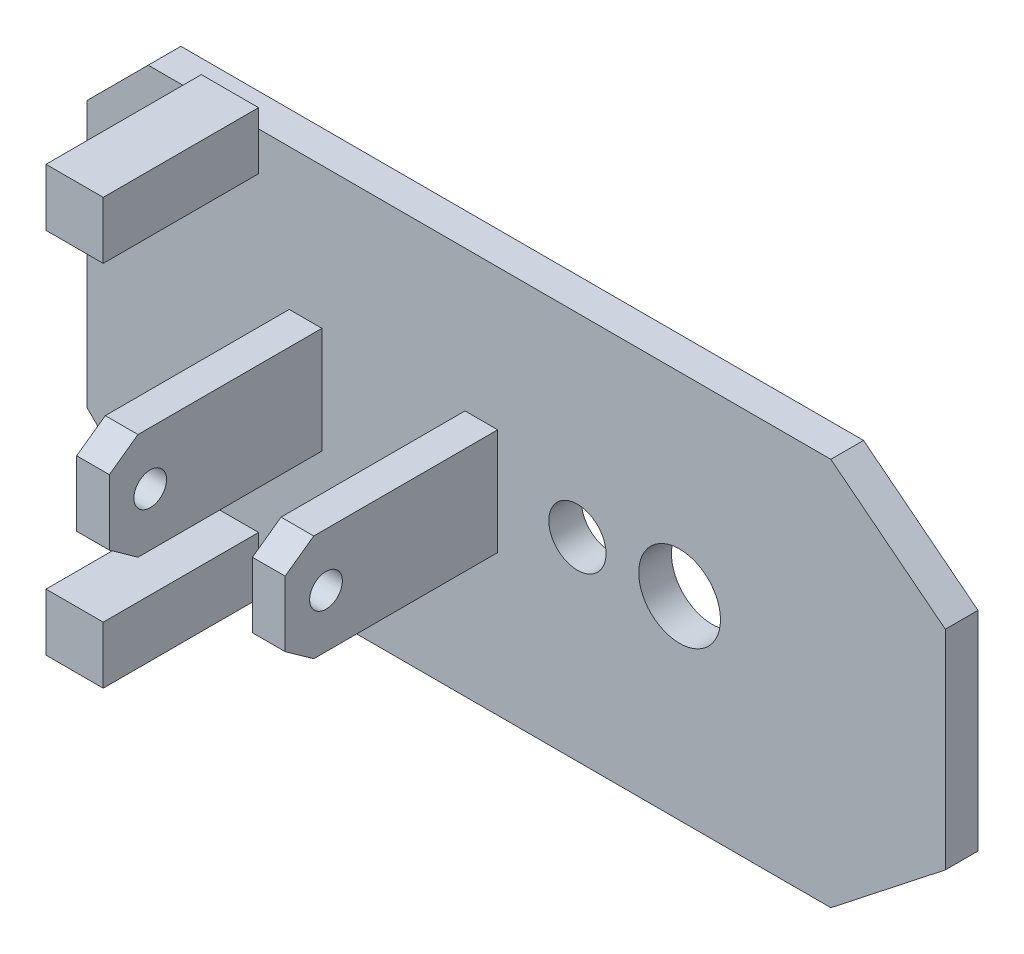
from build123d import *

# Parameters (mm, degrees)
SK_SOLE_PLATE_R    = 10
SK_SOLE_PLATE_R_2  = 7
SOLE_PLATE_DEPTH   = 8
SK_CLEVIS_FRONT_R  = 4
CLEVIS_FRONT_DEPTH = 8
SK_CLEVIS_BACK_R   = 4
CLEVIS_BACK_DEPTH  = 8
SK_POST_LAT_W      = 14
SK_POST_LAT_H      = 14
POST_LAT_DEPTH     = 38
SK_POST_MED_W      = 14
SK_POST_MED_H      = 14
POST_MED_DEPTH     = 38


with BuildPart() as part:
    # SK_Sole_Plate → Sole_Plate (new body)
    with BuildSketch(Plane.XY.offset(-50)):
        Polygon((-60, 47.5), (107, 47.5), (135, 25.5), (135, -25.5), (107, -47.5), (-60, -47.5), (-75, -32.5), (-75, 32.5), align=None)
        with Locations((70, 0)):
            Circle(SK_SOLE_PLATE_R, mode=Mode.SUBTRACT)
        with Locations((45, 0)):
            Circle(SK_SOLE_PLATE_R_2, mode=Mode.SUBTRACT)
    extrude(amount=SOLE_PLATE_DEPTH)

    # SK_Clevis_Front → Clevis_Front (add)
    with BuildSketch(Plane(origin=(17.5, 0, 0), x_dir=(0, 0, -1), z_dir=(1, 0, 0))):
        Polygon((42, 13), (42, -13), (-3, -13), (-10, -8), (-10, 8), (-3, 13), align=None)
        Circle(SK_CLEVIS_FRONT_R, mode=Mode.SUBTRACT)
    extrude(amount=CLEVIS_FRONT_DEPTH)

    # SK_Clevis_Back → Clevis_Back (add)
    with BuildSketch(Plane(origin=(-25.5, 0, 0), x_dir=(0, 0, -1), z_dir=(1, 0, 0))):
        Polygon((42, 13), (42, -13), (-3, -13), (-10, -8), (-10, 8), (-3, 13), align=None)
        Circle(SK_CLEVIS_BACK_R, mode=Mode.SUBTRACT)
    extrude(amount=CLEVIS_BACK_DEPTH)

    # SK_Post_Lat → Post_Lat (add)
    with BuildSketch(Plane.XY.offset(-42)):
        with Locations((-40, -45)):
            Rectangle(SK_POST_LAT_W, SK_POST_LAT_H)
    extrude(amount=POST_LAT_DEPTH)

    # SK_Post_Med → Post_Med (add)
    with BuildSketch(Plane.XY.offset(-42)):
        with Locations((-40, 45)):
            Rectangle(SK_POST_MED_W, SK_POST_MED_H)
    extrude(amount=POST_MED_DEPTH)


solid = part.part
